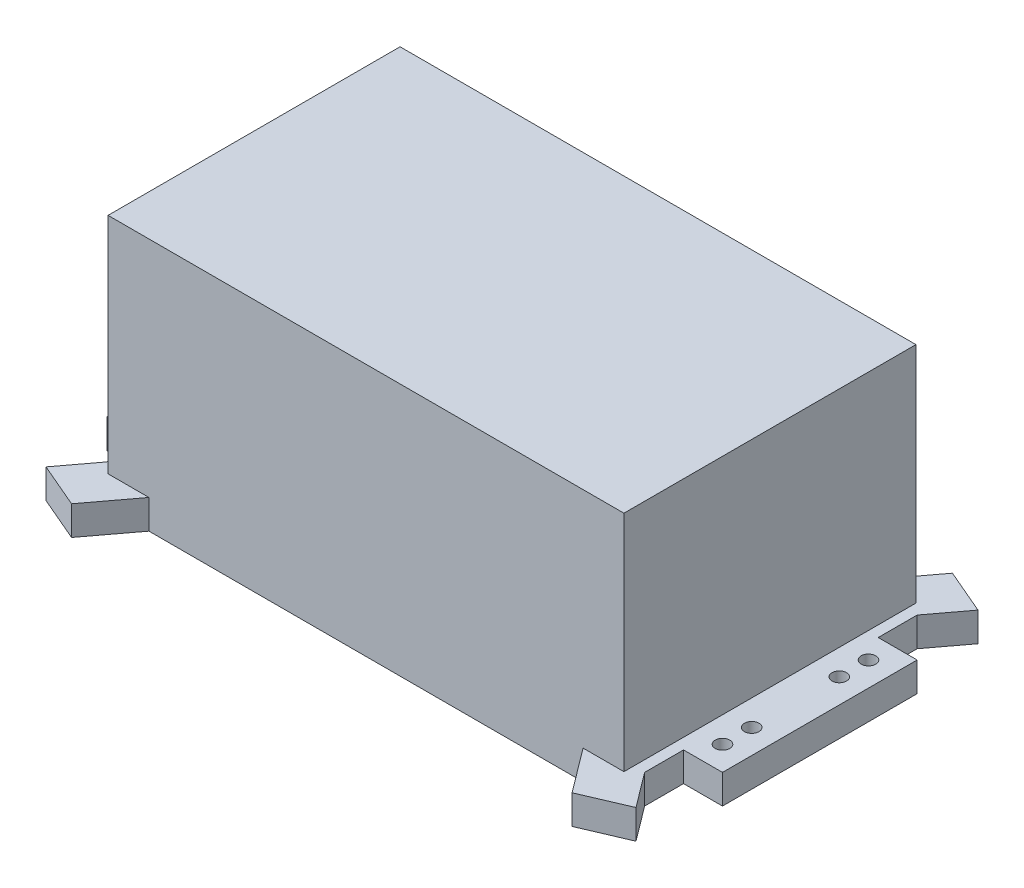
from build123d import *

# Parameters (mm, degrees)
SKETCH_1_R      = 1.5
EXTRUDE_1_DEPTH = 6
SKETCH_2_W      = 106
SKETCH_2_H      = 60
EXTRUDE_2_DEPTH = 46


with BuildPart() as part:
    # 草图1 → 凸台-拉伸1 (new body)
    with BuildSketch(Plane(origin=(0, 0, 0), x_dir=(1, 0, 0), z_dir=(0, 1, 0))):
        Polygon((44.601753779, -30), (-44.601753779, -30), (-51.423054046, -39.075905643), (-60.615391847, -35.138784137), (-55.25, -28), (-55.25, -20), (-63.25, -20), (-63.25, 20), (-55.25, 20), (-55.25, 28), (-60.615391847, 35.138784137), (-51.423054046, 39.075905643), (-44.601753779, 30), (44.601753779, 30), (51.423054046, 39.075905643), (60.615391847, 35.138784137), (55.25, 28), (55.25, 20), (63.25, 20), (63.25, -20), (55.25, -20), (55.25, -28), (60.615391847, -35.138784137), (51.423054046, -39.075905643), align=None)
        with Locations((58.25, 15)):
            Circle(SKETCH_1_R, mode=Mode.SUBTRACT)
        with Locations((-58.25, 15)):
            Circle(SKETCH_1_R, mode=Mode.SUBTRACT)
        with Locations((58.25, 9)):
            Circle(SKETCH_1_R, mode=Mode.SUBTRACT)
        with Locations((-58.25, 9)):
            Circle(SKETCH_1_R, mode=Mode.SUBTRACT)
        with Locations((58.25, -9)):
            Circle(SKETCH_1_R, mode=Mode.SUBTRACT)
        with Locations((58.25, -15)):
            Circle(SKETCH_1_R, mode=Mode.SUBTRACT)
        with Locations((-58.25, -9)):
            Circle(SKETCH_1_R, mode=Mode.SUBTRACT)
        with Locations((-58.25, -15)):
            Circle(SKETCH_1_R, mode=Mode.SUBTRACT)
    extrude(amount=EXTRUDE_1_DEPTH)

    # 草图2 → 凸台-拉伸2 (add)
    with BuildSketch(Plane(origin=(0, 6, 0), x_dir=(1, 0, 0), z_dir=(0, 1, 0))):
        Rectangle(SKETCH_2_W, SKETCH_2_H)
    extrude(amount=EXTRUDE_2_DEPTH)


solid = part.part
